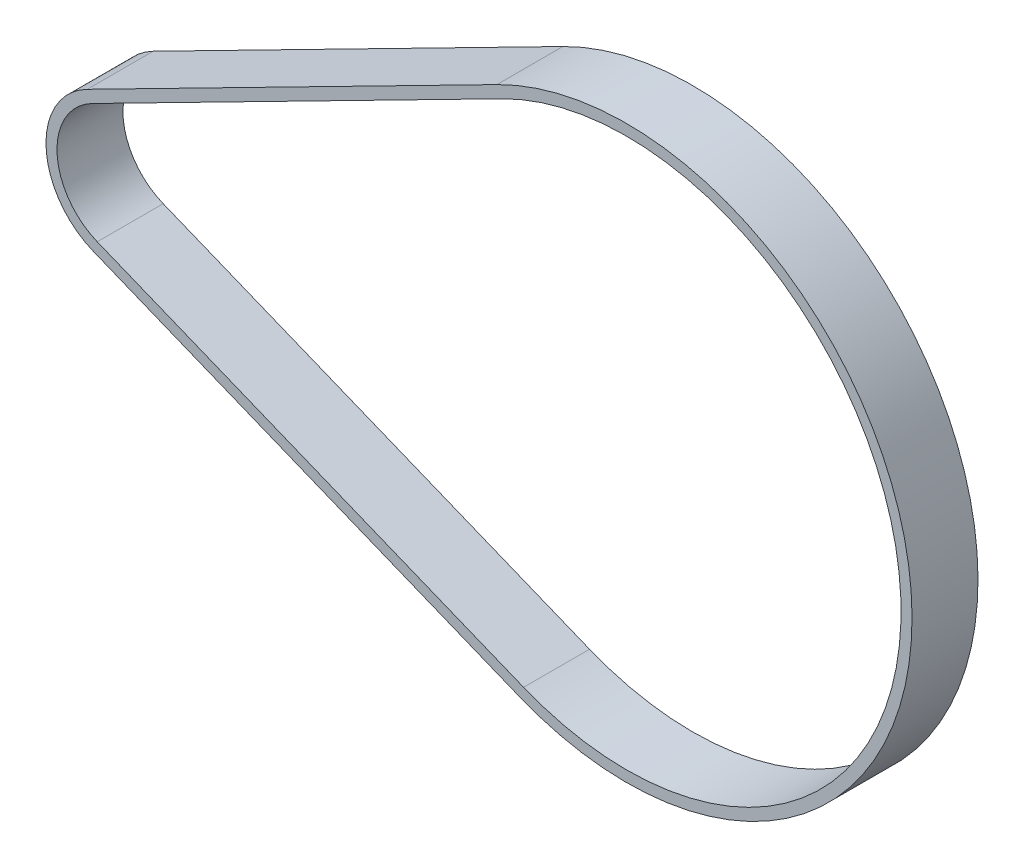
from build123d import *

# Parameters (mm, degrees)
EXTRUDE_THIN1_START = -1
EXTRUDE_THIN1_DEPTH = 6


with BuildPart() as part:
    # Sketch2 → Extrude-Thin1 (new body)
    with BuildSketch(Plane.XY.offset(EXTRUDE_THIN1_START)):
        with BuildLine():
            Line((-3.078931397, 3.616371619), (34.196297763, 22.62594253))
            ThreePointArc((34.196297763, 22.62594253), (71.933060641, 0.621091737), (36.244756546, -24.570606929))
            Line((36.244756546, -24.570606929), (-2.537330413, -8.862130674))
            ThreePointArc((-2.537330413, -8.862130674), (-6.818629464, -2.796946087), (-3.078931397, 3.616371619))
        make_face()
        with BuildLine():
            Line((-2.62462041, 2.725528463), (34.65060875, 21.735099374))
            ThreePointArc((34.65060875, 21.735099374), (70.93400121, 0.577729837), (36.620174454, -23.64375128))
            Line((36.620174454, -23.64375128), (-2.161912505, -7.935275025))
            ThreePointArc((-2.161912505, -7.935275025), (-5.819570034, -2.753584187), (-2.62462041, 2.725528463))
        make_face(mode=Mode.SUBTRACT)
    extrude(amount=-EXTRUDE_THIN1_DEPTH)


solid = part.part
